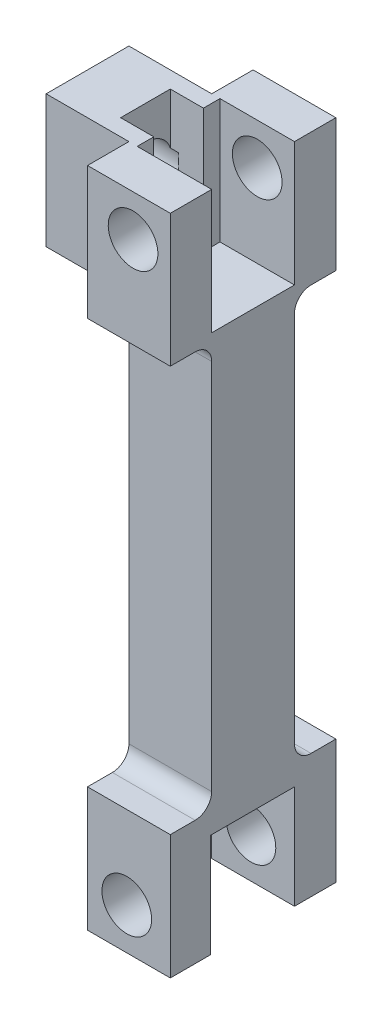
from build123d import *

# Parameters (mm, degrees)
BASE_EXTRUDE_DEPTH  = 25.4
SKETCH7_W           = 12.7
SKETCH7_H           = 38.1
BOSS_EXTRUDE5_DEPTH = 25.4
SKETCH8_W           = 25.751736715
SKETCH8_H           = 31.75
CUT_EXTRUDE5_DEPTH  = 25.4
SKETCH11_W          = 12.7
SKETCH11_H          = 40.64
BOSS_EXTRUDE6_DEPTH = 25.4
SKETCH12_W          = 25.4
SKETCH12_H          = 38.1
CUT_EXTRUDE7_DEPTH  = 22.86
SKETCH13_R          = 7.62
CUT_EXTRUDE8_DEPTH  = 20.32
CUT_EXTRUDE9_START  = -50.8
SKETCH14_R          = 7.62
CUT_EXTRUDE9_DEPTH  = 50.8
CUT_EXTRUDE10_REACH = 216.029
SKETCH15_W          = 20.32
SKETCH15_H          = 15.24
FILLET1_R           = 5.08


with BuildPart() as part:
    # Sketch1 → Base-Extrude (new body)
    with BuildSketch(Plane.XY):
        Polygon((-4.57611336, -135.706612686), (-29.97611336, -135.706612686), (-29.97611336, 26.853387314), (-55.37611336, 26.853387314), (-55.37611336, 67.493387314), (-29.97611336, 67.493387314), (-4.57611336, 67.493387314), align=None)
    extrude(amount=-BASE_EXTRUDE_DEPTH)

    # Sketch7 → Boss-Extrude5 (add)
    with BuildSketch(Plane.ZY.offset(29.97611336)):
        with Locations((-31.75, -116.656612686)):
            Rectangle(SKETCH7_W, SKETCH7_H)
        with Locations((6.35, -116.656612686)):
            Rectangle(SKETCH7_W, SKETCH7_H)
    extrude(amount=-BOSS_EXTRUDE5_DEPTH)

    # Sketch8 → Cut-Extrude5 (cut)
    with BuildSketch(Plane.ZY.offset(29.97611336)):
        with Locations((-12.524131643, -119.831612686)):
            Rectangle(SKETCH8_W, SKETCH8_H)
    extrude(amount=-CUT_EXTRUDE5_DEPTH, mode=Mode.SUBTRACT)

    # Sketch11 → Boss-Extrude6 (add)
    with BuildSketch(Plane(origin=(-4.57611336, 0, 0), x_dir=(0, 0, -1), z_dir=(1, 0, 0))):
        with Locations((31.75, 47.173387314)):
            Rectangle(SKETCH11_W, SKETCH11_H)
        with Locations((-6.35, 47.173387314)):
            Rectangle(SKETCH11_W, SKETCH11_H)
    extrude(amount=-BOSS_EXTRUDE6_DEPTH)

    # Sketch12 → Cut-Extrude7 (cut)
    with BuildSketch(Plane(origin=(-4.57611336, 0, 0), x_dir=(0, 0, -1), z_dir=(1, 0, 0))):
        with Locations((12.7, 48.443387314)):
            Rectangle(SKETCH12_W, SKETCH12_H)
    extrude(amount=-CUT_EXTRUDE7_DEPTH, mode=Mode.SUBTRACT)

    # Sketch13 → Cut-Extrude8 (cut)
    with BuildSketch(Plane.ZY.offset(55.37611336)):
        with Locations(Location((-13.088541232, 49.429752215, 0), (0, 0, 270))):
            Circle(SKETCH13_R)
    extrude(amount=-CUT_EXTRUDE8_DEPTH, mode=Mode.SUBTRACT)

    # Sketch14 → Cut-Extrude9 (cut)
    with BuildSketch(Plane(origin=(0, 0, -38.1), x_dir=(-1, 0, 0), z_dir=(0, 0, -1)).offset(CUT_EXTRUDE9_START)):
        with Locations(Location((16.00611336, 54.793387314, 0), (0, 0, 90))):
            Circle(SKETCH14_R)
        with Locations(Location((17.931310165, -123.006612686, 0), (0, 0, 90))):
            Circle(SKETCH14_R)
    extrude(amount=CUT_EXTRUDE9_DEPTH, mode=Mode.SUBTRACT)

    # Cut-Extrude10: up to this face of the body (flat: up to its plane)
    cut_extrude10_end = Plane(part.part.faces().sort_by_distance((-16.00611336, 29.393387314, -12.7))[0])
    # Sketch15 → Cut-Extrude10 (cut, up to the picked face)
    with BuildSketch(Plane(origin=(0, 67.493387314, 0), x_dir=(1, 0, 0), z_dir=(0, 1, 0)), mode=Mode.PRIVATE) as cut_extrude10_sk1:
        with Locations((-27.43611336, 12.7)):
            Rectangle(SKETCH15_W, SKETCH15_H)
    cut_extrude10_tool1 = split(extrude(cut_extrude10_sk1.sketch, amount=-CUT_EXTRUDE10_REACH, mode=Mode.PRIVATE), bisect_by=cut_extrude10_end, keep=Keep.BOTH, mode=Mode.PRIVATE)
    add(cut_extrude10_tool1.solids().sort_by(Axis((-27.436113, 67.493387, -12.7), (0, -1, 0)))[0], mode=Mode.SUBTRACT)

    # Fillet1
    # the kernel refuses this fillet: 5.08 mm, written as the material it adds along each edge
    with BuildSketch(Plane(origin=(-29.97611336, -97.606612686, 0), x_dir=(0, 1, 0), z_dir=(1, 0, 0)), Plane(origin=(-29.97611336, -97.606612686, -25.4), x_dir=(0, 0, -1), z_dir=(1, 0, 0)), Plane(origin=(-4.57611336, 26.853387314, 0), x_dir=(0, -1, 0), z_dir=(-1, 0, 0))) as fillet1_piece_1:
        with BuildLine():
            CenterArc((FILLET1_R, FILLET1_R), FILLET1_R, 180, 90)
            Line((0, FILLET1_R), (0, 0))
            Line((0, 0), (FILLET1_R, 0))
        make_face()
    extrude(amount=25.4)
    with BuildSketch(Plane(origin=(-4.57611336, 26.853387314, -25.4), x_dir=(0, -1, 0), z_dir=(-1, 0, 0))) as fillet1_piece_2:
        with BuildLine():
            CenterArc((FILLET1_R, -FILLET1_R), FILLET1_R, 90, 90)
            Line((0, -FILLET1_R), (0, 0))
            Line((0, 0), (FILLET1_R, 0))
        make_face()
    extrude(amount=25.4)


solid = part.part
